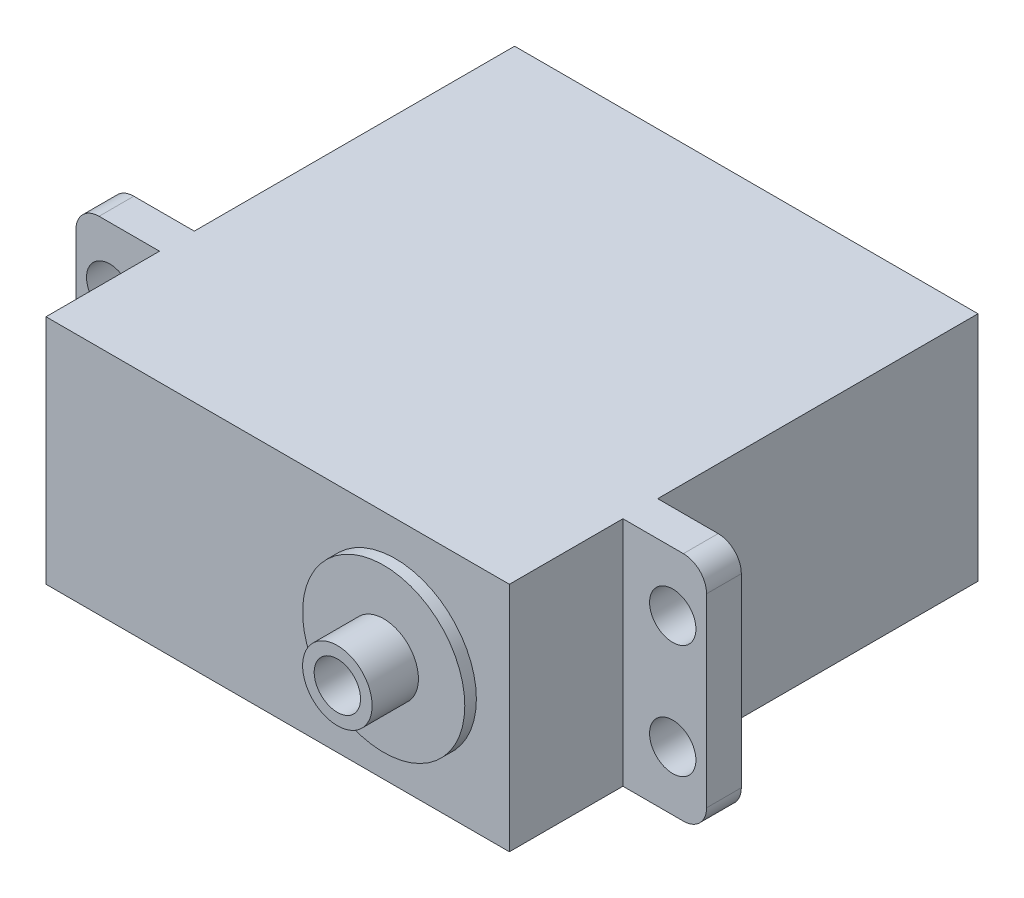
from build123d import *

# Parameters (mm, degrees)
SKETCH2_W           = 40
SKETCH2_H           = 20
BOSS_EXTRUDE1_DEPTH = 27.65
SKETCH3_W           = 54.44
SKETCH3_H           = 20
SKETCH3_R           = 2
BOSS_EXTRUDE2_DEPTH = 3
SKETCH4_W           = 40
SKETCH4_H           = 20
BOSS_EXTRUDE3_DEPTH = 9.8
SKETCH5_R           = 7
BOSS_EXTRUDE4_DEPTH = 1
SKETCH6_R           = 3
BOSS_EXTRUDE5_DEPTH = 4
FILLET1_R           = 2
SKETCH7_R           = 2
CUT_EXTRUDE1_DEPTH  = 10


with BuildPart() as part:
    # Sketch2 → Boss-Extrude1 (new body)
    with BuildSketch(Plane.XY):
        with Locations((-33.592215537, 218.387921433)):
            Rectangle(SKETCH2_W, SKETCH2_H)
    extrude(amount=BOSS_EXTRUDE1_DEPTH)

    # Sketch3 → Boss-Extrude2 (add)
    with BuildSketch(Plane.XY.offset(27.65)):
        with Locations((-33.592215537, 218.387921433)):
            Rectangle(SKETCH3_W, SKETCH3_H)
        with Locations((-9.292215537, 213.487921433)):
            Circle(SKETCH3_R, mode=Mode.SUBTRACT)
        with Locations((-9.292215537, 223.287921433)):
            Circle(SKETCH3_R, mode=Mode.SUBTRACT)
        with Locations((-57.892215537, 223.287921433)):
            Circle(SKETCH3_R, mode=Mode.SUBTRACT)
        with Locations((-57.892215537, 213.487921433)):
            Circle(SKETCH3_R, mode=Mode.SUBTRACT)
    extrude(amount=BOSS_EXTRUDE2_DEPTH)

    # Sketch4 → Boss-Extrude3 (add)
    with BuildSketch(Plane.XY.offset(30.65)):
        with Locations((-33.592215537, 218.387921433)):
            Rectangle(SKETCH4_W, SKETCH4_H)
    extrude(amount=BOSS_EXTRUDE3_DEPTH)

    # Sketch5 → Boss-Extrude4 (add)
    with BuildSketch(Plane.XY.offset(40.45)):
        with Locations((-23.442215537, 218.387921433)):
            Circle(SKETCH5_R)
    extrude(amount=BOSS_EXTRUDE4_DEPTH)

    # Sketch6 → Boss-Extrude5 (add)
    with BuildSketch(Plane.XY.offset(41.45)):
        with Locations((-23.442215537, 218.387921433)):
            Circle(SKETCH6_R)
    extrude(amount=BOSS_EXTRUDE5_DEPTH)

    # Fillet1
    fillet1_edges = [part.edges().sort_by_distance(p)[0] for p in [
        (-60.812215537, 228.387921433, 29.15),
        (-60.812215537, 208.387921433, 29.15),
        (-6.372215537, 228.387921433, 29.15),
        (-6.372215537, 208.387921433, 29.15),
    ]]
    fillet(fillet1_edges, radius=FILLET1_R)

    # Sketch7 → Cut-Extrude1 (cut)
    with BuildSketch(Plane.XY.offset(45.45)):
        with Locations((-23.442215537, 218.387921433)):
            Circle(SKETCH7_R)
    extrude(amount=-CUT_EXTRUDE1_DEPTH, mode=Mode.SUBTRACT)


solid = part.part
